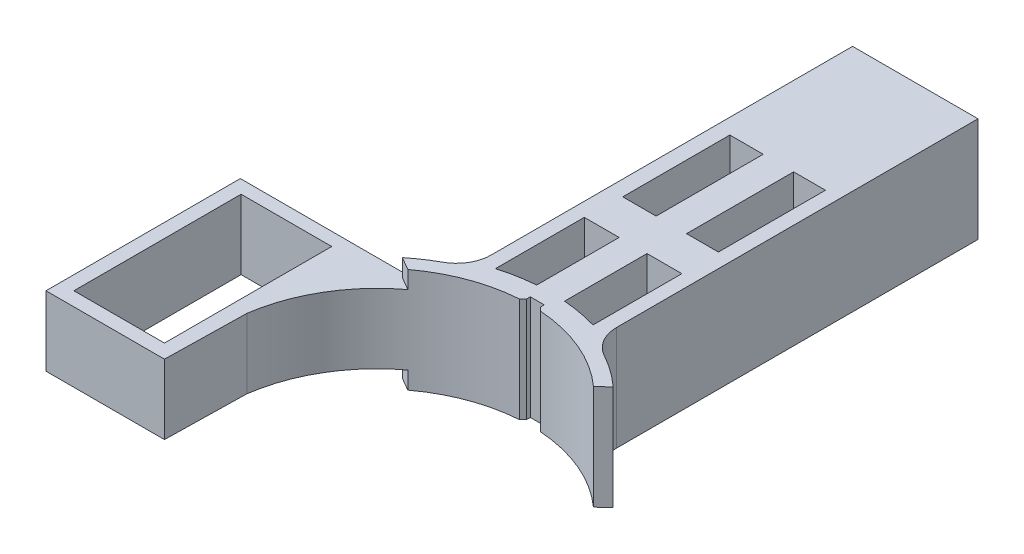
from build123d import *

# Parameters (mm, degrees)
SKETCH_1_W           = 20
SKETCH_1_H           = 20
SKETCH_1_W_2         = 11.5
SKETCH_1_H_2         = 11.5
EXTRUDE_1_DEPTH      = 7.5
EXTRUDE_2_DEPTH      = 20
SKETCH_4_W           = 6
SKETCH_4_H           = 17.5
CUT_EXTRUDE_1_DEPTH  = 33.882366095
SKETCH_5_R           = 2
CUT_EXTRUDE_2_DEPTH  = 35.820970693
SKETCH_6_OUTSIDE_W   = 31.014
SKETCH_6_OUTSIDE_H   = 48.514
SKETCH_6_OUTSIDE_W_2 = 18
SKETCH_6_OUTSIDE_H_2 = 37.5
CUT_EXTRUDE_5_DEPTH  = 33.882366095
EXTRUDE_3_DEPTH      = 15
CUT_EXTRUDE_6_DEPTH  = 75.578817368
CUT_EXTRUDE_9_DEPTH  = 37.120005833
SKETCH_12_W          = 2
SKETCH_12_H          = 2
CUT_EXTRUDE_10_DEPTH = 16
EXTRUDE_START        = -15
EXTRUDE_4_DEPTH      = 15
SKETCH_14_W          = 13
SKETCH_14_H          = 24
EXTRUDE_5_DEPTH      = 5
FILLET_3_R           = 5
CHAMFER_1_SIZE       = 0.5
CUT_EXTRUDE_11_DEPTH = 64
SKETCH_16_W          = 18
SKETCH_16_H          = 15
EXTRUDE_6_DEPTH      = 3
SKETCH_17_W          = 18
SKETCH_17_H          = 15
EXTRUDE_7_DEPTH      = 35
SKETCH_18_W          = 4.570911685
SKETCH_18_H          = 15.367720323
SKETCH_18_W_2        = 4.787102878
CUT_EXTRUDE_12_DEPTH = 66
SKETCH_19_R          = 2
CUT_EXTRUDE_13_DEPTH = 16


with BuildPart() as part:
    # 草图1 → 凸台-拉伸1 (new, symmetric)
    with BuildSketch(Plane(origin=(0, 0, 0), x_dir=(1, 0, 0), z_dir=(0, 1, 0))):
        Rectangle(SKETCH_1_W, SKETCH_1_H)
        Rectangle(SKETCH_1_W_2, SKETCH_1_H_2, mode=Mode.SUBTRACT)
    extrude(amount=EXTRUDE_1_DEPTH, both=True)

    # 草图3 → 凸台-拉伸2 (add)
    with BuildSketch(Plane.ZY.offset(10)):
        with BuildLine():
            Line((-10, -5), (-14.409830056, -5))
            ThreePointArc((-14.409830056, -5), (-27.5, 0), (-14.409830056, 5))
            Line((-14.409830056, 5), (-10, 5))
            Line((-10, 5), (-10, -5))
        make_face()
    extrude(amount=-EXTRUDE_2_DEPTH)

    # 草图4 → 切除-拉伸1 (cut, through all)
    with BuildSketch(Plane(origin=(0, 7.5, 0), x_dir=(1, 0, 0), z_dir=(0, 1, 0))):
        with Locations((-0.204363536, 18.75)):
            Rectangle(SKETCH_4_W, SKETCH_4_H)
    extrude(amount=-CUT_EXTRUDE_1_DEPTH, mode=Mode.SUBTRACT)

    # 草图5 → 切除-拉伸2 (cut, through all)
    with BuildSketch(Plane.ZY.offset(10)):
        with Locations((-20, 0)):
            Circle(SKETCH_5_R)
    extrude(amount=-CUT_EXTRUDE_2_DEPTH, mode=Mode.SUBTRACT)

    # 草图6 outside → 切除-拉伸5 (cut, through all)
    with BuildSketch(Plane(origin=(0, 7.5, 0), x_dir=(1, 0, 0), z_dir=(0, 1, 0))):
        with Locations((0, 8.75)):
            Rectangle(SKETCH_6_OUTSIDE_W, SKETCH_6_OUTSIDE_H)
        with Locations((0, 8.75)):
            Rectangle(SKETCH_6_OUTSIDE_W_2, SKETCH_6_OUTSIDE_H_2, mode=Mode.SUBTRACT)
    extrude(amount=-CUT_EXTRUDE_5_DEPTH, mode=Mode.SUBTRACT)


with BuildPart() as body_2:
    # 草图7 → 凸台-拉伸3 (new body)
    with BuildSketch(Plane.XZ.offset(7.5)):
        with BuildLine():
            Line((-9, 10), (-9, 22.751404539))
            ThreePointArc((-9, 22.751404539), (0, 69), (9, 22.751404539))
            Line((9, 22.751404539), (9, 10))
            Line((9, 10), (-9, 10))
        make_face()
    extrude(amount=-EXTRUDE_3_DEPTH)

    # 草图10 → 切除-拉伸6 (cut, through all)
    with BuildSketch(Plane(origin=(0, 7.5, 0), x_dir=(1, 0, 0), z_dir=(0, 1, 0))):
        with BuildLine():
            Line((-13.184152869, -27.388125792), (-20.784609691, -23))
            ThreePointArc((-20.784609691, -23), (0, -75.265491901), (20.784609691, -23))
            Line((20.784609691, -23), (14.677253023, -28.611643044))
            ThreePointArc((14.677253023, -28.611643044), (0.965186839, -23.021182599), (-13.184152869, -27.388125792))
        make_face()
    extrude(amount=-CUT_EXTRUDE_6_DEPTH, mode=Mode.SUBTRACT)


with BuildPart() as part_1:
    add(part.part)

    # Combine 1: union body 2
    add(body_2.part)

    # 草图11 → 切除-拉伸9 (cut, through all)
    with BuildSketch(Plane(origin=(0, 7.5, 0), x_dir=(1, 0, 0), z_dir=(0, 1, 0))):
        with BuildLine():
            Line((-7, -8.25), (7, -8.25))
            Line((7, -8.25), (7, -21))
            ThreePointArc((7, -21), (0, -20), (-7, -21))
            Line((-7, -21), (-7, -8.25))
        make_face()
    extrude(amount=-CUT_EXTRUDE_9_DEPTH, mode=Mode.SUBTRACT)

    # 草图12 → 切除-拉伸10 (cut)
    with BuildSketch(Plane(origin=(0, 7.5, 0), x_dir=(1, 0, 0), z_dir=(0, 1, 0))):
        with Locations((0, -23)):
            Rectangle(SKETCH_12_W, SKETCH_12_H)
    extrude(amount=-CUT_EXTRUDE_10_DEPTH, mode=Mode.SUBTRACT)

    # 草图13 → 凸台-拉伸4 (add)
    with BuildSketch(Plane.XZ.offset(7.5).offset(EXTRUDE_START)):
        with BuildLine():
            Line((-2, 20.080128411), (-2, 8.25))
            Line((-2, 8.25), (2, 8.25))
            Line((2, 8.25), (2, 20.080128411))
            ThreePointArc((2, 20.080128411), (0, 20), (-2, 20.080128411))
        make_face()
    extrude(amount=EXTRUDE_4_DEPTH)

    # 草图14 → 凸台-拉伸5 (add, symmetric)
    with BuildSketch(Plane(origin=(0, 0, 0), x_dir=(1, 0, 0), z_dir=(0, 1, 0))):
        with BuildLine():
            Line((-39.000369788, -25.608987518), (-10.391758029, -25.608987518))
            ThreePointArc((-10.391758029, -25.608987518), (-18.019377527, -32.37850906), (-21.774804011, -41.860269078))
            Line((-21.774804011, -41.860269078), (-22.000976364, -53.5))
            Line((-22.000976364, -53.5), (-39.000369788, -53.5))
            Line((-39.000369788, -53.5), (-39.000369788, -25.608987518))
        make_face()
        with Locations((-30.500369788, -39.5)):
            Rectangle(SKETCH_14_W, SKETCH_14_H, mode=Mode.SUBTRACT)
    extrude(amount=EXTRUDE_5_DEPTH, both=True)

    # 圆角3
    fillet_3_edges = [part_1.edges().sort_by_distance(p)[0] for p in [
        (-9, 0, 22.751404539),
        (9, 0, 22.751404539),
    ]]
    fillet(fillet_3_edges, radius=FILLET_3_R)

    # 倒角1
    # the kernel refuses this chamfer: 0.524377325, 0.5 mm, written as the material it takes off along each edge
    with BuildSketch(Plane(origin=(1, -8.868212894, 23.022739024), x_dir=(0.9983445219574435, 0, 0.05751708856995105), z_dir=(0, 1, 0))) as chamfer_1_piece_1:
        with BuildLine():
            Line((0.531447088, 0), (-CHAMFER_1_SIZE * 0.05751708857, CHAMFER_1_SIZE * 0.998344521957))
            Line((-CHAMFER_1_SIZE * 0.05751708857, CHAMFER_1_SIZE * 0.998344521957), (0, 0))
            ThreePointArc((0, 0), (0.273556674, 0.001603414), (0.531447088, 0))
        make_face()
    extrude(amount=17.736425787, mode=Mode.SUBTRACT)
    with BuildSketch(Plane(origin=(-1, -8.868212894, 23.022739024), x_dir=(-0.9983445219574435, 0, 0.05751708856995064), z_dir=(0, 1, 0))) as chamfer_1_piece_2:
        with BuildLine():
            Line((0.531447088, 0), (-CHAMFER_1_SIZE * 0.05751708857, -CHAMFER_1_SIZE * 0.998344521957))
            Line((-CHAMFER_1_SIZE * 0.05751708857, -CHAMFER_1_SIZE * 0.998344521957), (0, 0))
            ThreePointArc((0, 0), (0.273556674, -0.001603414), (0.531447088, 0))
        make_face()
    extrude(amount=17.736425787, mode=Mode.SUBTRACT)

    # 草图15 → 切除-拉伸11 (cut)
    with BuildSketch(Plane(origin=(0, 7.5, 0), x_dir=(1, 0, 0), z_dir=(0, 1, 0))):
        Polygon((-5.75, -5.75), (20.030525029, -5.75), (22.202632228, 33.927378984), (-42.503618679, 32.062961585), (-42.503618679, 30.637230633), (-36.910366482, 4.316043823), (-9, -5.75), align=None)
    extrude(amount=-CUT_EXTRUDE_11_DEPTH, mode=Mode.SUBTRACT)

    # 草图16 → 凸台-拉伸6 (add)
    with BuildSketch(Plane(origin=(0, 0, 5.75), x_dir=(-1, 0, 0), z_dir=(0, 0, -1))):
        Rectangle(SKETCH_16_W, SKETCH_16_H)
    extrude(amount=EXTRUDE_6_DEPTH)

    # 草图17 → 凸台-拉伸7 (add)
    with BuildSketch(Plane(origin=(0, 0, 2.75), x_dir=(-1, 0, 0), z_dir=(0, 0, -1))):
        Rectangle(SKETCH_17_W, SKETCH_17_H)
    extrude(amount=EXTRUDE_7_DEPTH)

    # 草图18 → 切除-拉伸12 (cut)
    with BuildSketch(Plane.XZ.offset(7.5)):
        with Locations((4.649601127, -4.742503957)):
            Rectangle(SKETCH_18_W, SKETCH_18_H)
        with Locations((-4.393551439, -4.742503957)):
            Rectangle(SKETCH_18_W_2, SKETCH_18_H)
    extrude(amount=-CUT_EXTRUDE_12_DEPTH, mode=Mode.SUBTRACT)

    # 草图19 → 切除-拉伸13 (cut)
    with BuildSketch(Plane(origin=(0, 0, -32.25), x_dir=(-1, 0, 0), z_dir=(0, 0, -1))):
        with Locations((-4, 4)):
            Circle(SKETCH_19_R)
        with Locations((4, 4)):
            Circle(SKETCH_19_R)
        with Locations(Location((4, -4, 0), (0, 0, 180))):
            Circle(SKETCH_19_R)
        with Locations(Location((-4, -4, 0), (0, 0, 180))):
            Circle(SKETCH_19_R)
    extrude(amount=-CUT_EXTRUDE_13_DEPTH, mode=Mode.SUBTRACT)


solid = part_1.part
